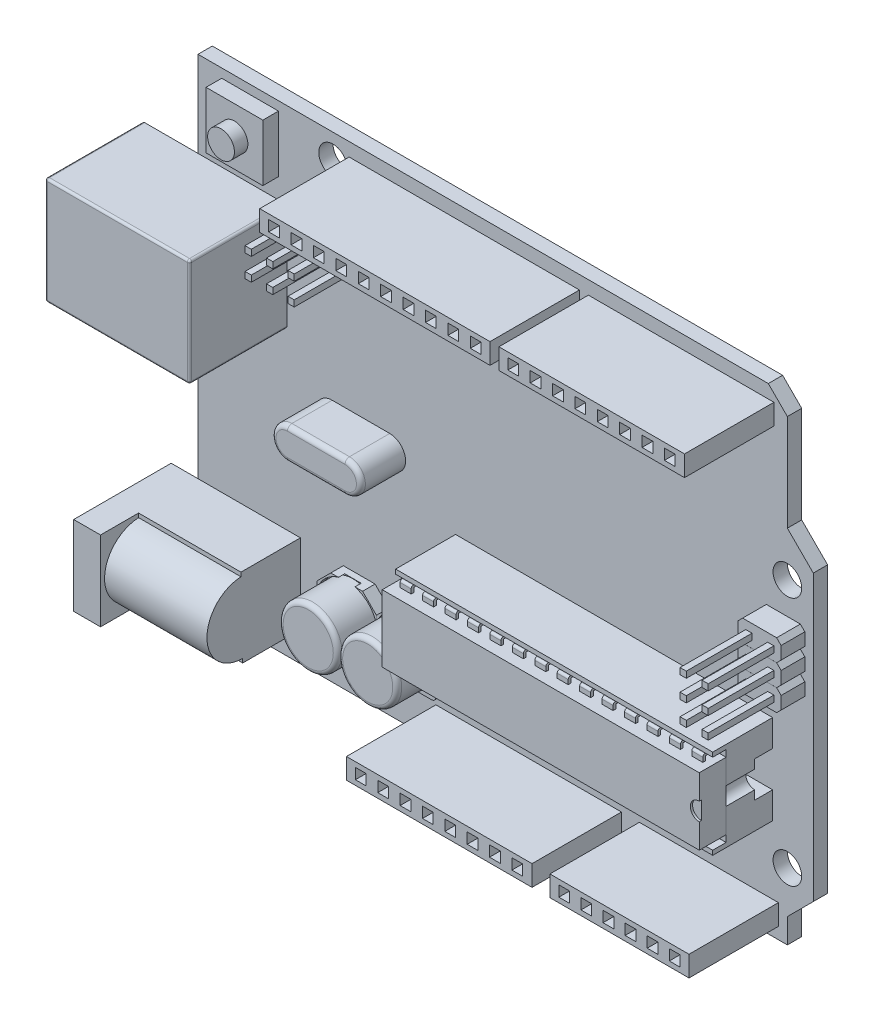
from build123d import *

# Parameters (mm, degrees)
ESQUISSE1_R                = 1.6
BOSS_EXTRU_1_DEPTH         = 1.6
ESQUISSE2_W                = 16.15
ESQUISSE2_H                = 12
BOSS_EXTRU_2_DEPTH         = 10.9
ESQUISSE3_W                = 14.45
ESQUISSE3_H                = 8.9
BOSS_EXTRU_3_DEPTH         = 10.9
ESQUISSE4_W                = 15.55
ESQUISSE4_H                = 2.3
ESQUISSE4_W_2              = 1.2
ESQUISSE4_H_2              = 1.2
BOSS_EXTRU_4_DEPTH         = 10
ENL_V_MAT_EXTRU_1_DEPTH    = 11.45
BOSS_EXTRU_5_DEPTH         = 5
ESQUISSE8_W                = 20.75
ESQUISSE8_H                = 2.3
ESQUISSE8_W_2              = 1.2
ESQUISSE8_H_2              = 1.2
BOSS_EXTRU_6_DEPTH         = 10
BOSS_EXTRU_7_DEPTH         = 1.4
ESQUISSE10_R               = 3.45
ENL_V_MAT_EXTRU_8_DEPTH    = 0.7
R_P_TITION_LIN_AIRE1_COUNT = 2
R_P_TITION_LIN_AIRE1_PITCH = 6.65
ESQUISSE11_R               = 3.3
BOSS_EXTRU_8_DEPTH         = 5
R_P_TITION_LIN_AIRE2_COUNT = 2
R_P_TITION_LIN_AIRE2_PITCH = 6.65
CONG_1_R                   = 0.5
CONG_2_R                   = 0.5
CONG_3_R                   = 0.5
BOSS_EXTRU_9_DEPTH         = 2.65
R_P_TITION_LIN_AIRE3_COUNT = 3
R_P_TITION_LIN_AIRE3_PITCH = 2.42
BOSS_EXTRU_10_DEPTH        = 2.65
R_P_TITION_LIN_AIRE4_COUNT = 3
R_P_TITION_LIN_AIRE4_PITCH = 2.42
ESQUISSE14_W               = 6.35
ESQUISSE14_H               = 6.35
BOSS_EXTRU_11_DEPTH        = 1.75
ESQUISSE15_R               = 1.5
BOSS_EXTRU_12_DEPTH        = 1.5
ESQUISSE16_W               = 0.7
ESQUISSE16_H               = 0.7
BOSS_EXTRU_13_DEPTH        = 7.35
BOSS_EXTRU_13_2_DEPTH      = 7.35
BOSS_EXTRU_13_3_DEPTH      = 7.35
BOSS_EXTRU_13_4_DEPTH      = 7.35
BOSS_EXTRU_13_5_DEPTH      = 7.35
BOSS_EXTRU_13_6_DEPTH      = 7.35
ESQUISSE17_W               = 0.7
ESQUISSE17_H               = 0.7
BOSS_EXTRU_14_DEPTH        = 7.35
BOSS_EXTRU_14_2_DEPTH      = 7.35
BOSS_EXTRU_14_3_DEPTH      = 7.35
BOSS_EXTRU_14_4_DEPTH      = 7.35
BOSS_EXTRU_14_5_DEPTH      = 7.35
BOSS_EXTRU_14_6_DEPTH      = 7.35
ESQUISSE19_W               = 20.75
ESQUISSE19_H               = 2.3
ESQUISSE19_W_2             = 1.2
ESQUISSE19_H_2             = 1.2
BOSS_EXTRU_15_DEPTH        = 10
ESQUISSE20_W               = 25.75
ESQUISSE20_H               = 2.3
ESQUISSE20_W_2             = 1.2
ESQUISSE20_H_2             = 1.2
BOSS_EXTRU_16_DEPTH        = 10
BOSS_EXTRU_17_DEPTH        = 6.7
ENL_V_START                = -64.25
ESQUISSE22_W               = 2
ESQUISSE22_H               = 4
ESQUISSE22_W_2             = 1.5
ESQUISSE22_H_2             = 9
ENL_V_MAT_EXTRU_9_DEPTH    = 68.8
ESQUISSE23_W               = 35.45
ESQUISSE23_H               = 7.5
BOSS_EXTRU_18_DEPTH        = 3
BOSS_EXTRU_19_START        = -1.2
ESQUISSE24_W               = 1.232150756
ESQUISSE24_H               = 0.75
BOSS_EXTRU_19_DEPTH        = 1.8
ESQUISSE24_W_2             = 1.232150757
BOSS_EXTRU_19_2_DEPTH      = 1.8
BOSS_EXTRU_19_3_DEPTH      = 1.8
BOSS_EXTRU_19_4_DEPTH      = 1.8
BOSS_EXTRU_19_5_DEPTH      = 1.8
BOSS_EXTRU_19_6_DEPTH      = 1.8
BOSS_EXTRU_19_7_DEPTH      = 1.8
BOSS_EXTRU_19_8_DEPTH      = 1.8
BOSS_EXTRU_19_9_DEPTH      = 1.8
BOSS_EXTRU_19_10_DEPTH     = 1.8
BOSS_EXTRU_19_11_DEPTH     = 1.8
BOSS_EXTRU_19_12_DEPTH     = 1.8
BOSS_EXTRU_19_13_DEPTH     = 1.8
BOSS_EXTRU_19_14_DEPTH     = 1.8
BOSS_EXTRU_19_15_DEPTH     = 1.8
BOSS_EXTRU_19_16_DEPTH     = 1.8
BOSS_EXTRU_19_17_DEPTH     = 1.8
BOSS_EXTRU_19_18_DEPTH     = 1.8
BOSS_EXTRU_19_19_DEPTH     = 1.8
BOSS_EXTRU_19_20_DEPTH     = 1.8
BOSS_EXTRU_19_21_DEPTH     = 1.8
BOSS_EXTRU_19_22_DEPTH     = 1.8
BOSS_EXTRU_19_23_DEPTH     = 1.8
BOSS_EXTRU_19_24_DEPTH     = 1.8
BOSS_EXTRU_19_25_DEPTH     = 1.8
BOSS_EXTRU_19_26_DEPTH     = 1.8
BOSS_EXTRU_19_27_DEPTH     = 1.8
BOSS_EXTRU_19_28_DEPTH     = 1.8
CONG_4_R                   = 0.25
CONG_5_R                   = 0.25
CONG_6_R                   = 0.25
CONG_7_R                   = 0.25
CONG_8_R                   = 0.25
CONG_9_R                   = 0.25
CONG_10_R                  = 0.25
CONG_11_R                  = 0.25
CONG_12_R                  = 0.25
CONG_13_R                  = 0.25
CONG_14_R                  = 0.25
CONG_15_R                  = 0.25
CONG_16_R                  = 0.25
CONG_17_R                  = 0.25
CONG_18_R                  = 0.25
CONG_19_R                  = 0.25
CONG_20_R                  = 0.25
CONG_21_R                  = 0.25
CONG_22_R                  = 0.25
CONG_23_R                  = 0.25
CONG_24_R                  = 0.25
CONG_25_R                  = 0.25
CONG_26_R                  = 0.25
CONG_27_R                  = 0.25
CONG_28_R                  = 0.25
CONG_29_R                  = 0.25
ESQUISSE25_R               = 3.05
ESQUISSE25_R_2             = 1
ENL_V_MAT_EXTRU_10_DEPTH   = 11
CONG_30_R                  = 1
ESQUISSE26_W               = 3
ESQUISSE26_H               = 5.25
ENL_V_MAT_EXTRU_11_DEPTH   = 10.15
ENL_V_START_2              = -34.65
ESQUISSE27_W               = 1.5
ESQUISSE27_H               = 0.5
ENL_V_MAT_EXTRU_12_DEPTH   = 35.45
CONG_31_R                  = 0.25
CONG_32_R                  = 0.25
CONG_33_R                  = 0.25
ESQUISSE28_R               = 1
ENL_V_MAT_EXTRU_13_DEPTH   = 0.25
ESQUISSE29_W               = 3
ESQUISSE29_H               = 3.9
BOSS_EXTRU_20_DEPTH        = 0.25
CONG_34_R                  = 0.25
BOSS_EXTRU_21_START        = -2
ESQUISSE30_W               = 0.3
ESQUISSE30_H               = 0.7
BOSS_EXTRU_21_DEPTH        = 8.15
BOSS_EXTRU_21_2_DEPTH      = 8.15
BOSS_EXTRU_21_3_DEPTH      = 8.15
BOSS_EXTRU_21_4_DEPTH      = 8.15


with BuildPart() as part:
    # Esquisse1 → Boss.-Extru.1 (new body)
    with BuildSketch(Plane.XY):
        Polygon((0, 0), (0, 53.3), (63.768866738, 53.3), (65.9, 51.168866738), (65.9, 40.358859802), (68.8, 37.458859802), (68.8, 5.65), (65.9, 2.75), (65.9, 0), align=None)
        with Locations((14, 2.75)):
            Circle(ESQUISSE1_R, mode=Mode.SUBTRACT)
        with Locations((15.1, 50.55)):
            Circle(ESQUISSE1_R, mode=Mode.SUBTRACT)
        with Locations((65.9, 7.45)):
            Circle(ESQUISSE1_R, mode=Mode.SUBTRACT)
        with Locations((65.9, 35.35)):
            Circle(ESQUISSE1_R, mode=Mode.SUBTRACT)
    extrude(amount=BOSS_EXTRU_1_DEPTH)

    # Esquisse13 → Boss.-Extru.10 (add)
    with BuildSketch(Plane.XY.offset(1.6)):
        Polygon((14.4, 43.9), (14.4, 47.7), (14.9, 48.2), (16.316666667, 48.2), (16.816666667, 47.7), (16.816666667, 43.9), (16.316666667, 43.4), (14.9, 43.4), align=None)
    boss_extru_10 = extrude(amount=BOSS_EXTRU_10_DEPTH)

    # Répétition linéaire4: Boss.-Extru.10 ×3
    with Locations(*[(i * R_P_TITION_LIN_AIRE4_PITCH, 0, 0) for i in range(1, R_P_TITION_LIN_AIRE4_COUNT)]):
        add(boss_extru_10)


with BuildPart() as body_2:
    # Esquisse2 → Boss.-Extru.2 (new body)
    with BuildSketch(Plane.XY.offset(1.6)):
        with Locations((1.875, 37.7)):
            Rectangle(ESQUISSE2_W, ESQUISSE2_H)
    extrude(amount=BOSS_EXTRU_2_DEPTH)

    # Congé29
    cong_29_edges = [body_2.edges().sort_by_distance(p)[0] for p in [
        (9.95, 37.7, 12.5),
        (1.875, 43.7, 12.5),
        (-6.2, 37.7, 12.5),
        (1.875, 31.7, 12.5),
        (-6.2, 43.7, 7.05),
        (9.95, 43.7, 7.05),
        (9.95, 31.7, 7.05),
        (-6.2, 31.7, 7.05),
    ]]
    fillet(cong_29_edges, radius=CONG_29_R)

    # Esquisse26 → Enlèv. mat.-Extru.11 (cut)
    with BuildSketch(Plane.ZY.offset(6.2)):
        Polygon((9.55, 41.947925456), (3.75, 41.947925456), (3.75, 33.447925456), (9.55, 33.447925456), (11.3, 35.197925456), (11.3, 40.197925456), align=None)
        with Locations((7.45, 37.697925456)):
            Rectangle(ESQUISSE26_W, ESQUISSE26_H, mode=Mode.SUBTRACT)
    extrude(amount=-ENL_V_MAT_EXTRU_11_DEPTH, mode=Mode.SUBTRACT)


with BuildPart() as body_3:
    # Esquisse3 → Boss.-Extru.3 (new body)
    with BuildSketch(Plane.XY.offset(1.6)):
        with Locations((4.225, 7.75)):
            Rectangle(ESQUISSE3_W, ESQUISSE3_H)
    extrude(amount=BOSS_EXTRU_3_DEPTH)

    # Esquisse5 → Enlèv. mat.-Extru.1 (cut)
    with BuildSketch(Plane(origin=(11.45, 0, 0), x_dir=(0, 0, -1), z_dir=(1, 0, 0))):
        with BuildLine():
            Line((-8.050002587, 3.754798233), (-8.050002587, 3.3))
            Line((-8.050002587, 3.3), (-12.5, 3.3))
            Line((-12.5, 3.3), (-12.5, 12.2))
            Line((-12.5, 12.2), (-8.245866933, 12.2))
            Line((-8.245866933, 12.2), (-8.245866933, 11.75))
            ThreePointArc((-8.245866933, 11.75), (-12.048802849, 7.656836678), (-8.050002587, 3.754798233))
        make_face()
    extrude(amount=-ENL_V_MAT_EXTRU_1_DEPTH, mode=Mode.SUBTRACT)

    # Esquisse25 → Enlèv. mat.-Extru.10 (cut)
    with BuildSketch(Plane.ZY.offset(3)):
        with Locations(Location((8.1, 7.8, 0), (0, 0, 270))):
            Circle(ESQUISSE25_R)
        with Locations(Location((8.1, 7.8, 0), (0, 0, 270))):
            Circle(ESQUISSE25_R_2, mode=Mode.SUBTRACT)
    extrude(amount=-ENL_V_MAT_EXTRU_10_DEPTH, mode=Mode.SUBTRACT)

    # Congé30
    cong_30_edges = [body_3.edges().sort_by_distance(p)[0] for p in [
        (-3, 8.8, 8.1),
    ]]
    fillet(cong_30_edges, radius=CONG_30_R)


with BuildPart() as body_4:
    # Esquisse4 → Boss.-Extru.4 (new body)
    with BuildSketch(Plane.XY.offset(1.6)):
        with Locations((57.125, 2.45)):
            Rectangle(ESQUISSE4_W, ESQUISSE4_H)
        with Locations((50.95, 2.45)):
            Rectangle(ESQUISSE4_W_2, ESQUISSE4_H_2, mode=Mode.SUBTRACT)
        with Locations((53.42, 2.45)):
            Rectangle(ESQUISSE4_W_2, ESQUISSE4_H_2, mode=Mode.SUBTRACT)
        with Locations((55.89, 2.45)):
            Rectangle(ESQUISSE4_W_2, ESQUISSE4_H_2, mode=Mode.SUBTRACT)
        with Locations((58.36, 2.45)):
            Rectangle(ESQUISSE4_W_2, ESQUISSE4_H_2, mode=Mode.SUBTRACT)
        with Locations((60.83, 2.45)):
            Rectangle(ESQUISSE4_W_2, ESQUISSE4_H_2, mode=Mode.SUBTRACT)
        with Locations((63.3, 2.45)):
            Rectangle(ESQUISSE4_W_2, ESQUISSE4_H_2, mode=Mode.SUBTRACT)
    extrude(amount=BOSS_EXTRU_4_DEPTH)


with BuildPart() as body_5:
    # Esquisse6 → Boss.-Extru.5 (new body)
    with BuildSketch(Plane.XY.offset(1.6)):
        with BuildLine():
            Line((15, 27.3), (21.44, 27.3))
            ThreePointArc((21.44, 27.3), (23.215, 25.525), (21.44, 23.75))
            Line((21.44, 23.75), (15, 23.75))
            ThreePointArc((15, 23.75), (13.225, 25.525), (15, 27.3))
        make_face()
    extrude(amount=BOSS_EXTRU_5_DEPTH)

    # Congé3
    cong_3_edges = [body_5.edges().sort_by_distance(p)[0] for p in [
        (23.215, 25.525, 6.6),
        (18.22, 27.3, 6.6),
        (13.225, 25.525, 6.6),
        (18.22, 23.75, 6.6),
    ]]
    fillet(cong_3_edges, radius=CONG_3_R)


with BuildPart() as body_6:
    # Esquisse8 → Boss.-Extru.6 (new body)
    with BuildSketch(Plane.XY.offset(1.6)):
        with Locations((36.975, 2.45)):
            Rectangle(ESQUISSE8_W, ESQUISSE8_H)
        with Locations((28.2, 2.45)):
            Rectangle(ESQUISSE8_W_2, ESQUISSE8_H_2, mode=Mode.SUBTRACT)
        with Locations((30.7, 2.45)):
            Rectangle(ESQUISSE8_W_2, ESQUISSE8_H_2, mode=Mode.SUBTRACT)
        with Locations((33.2, 2.45)):
            Rectangle(ESQUISSE8_W_2, ESQUISSE8_H_2, mode=Mode.SUBTRACT)
        with Locations((35.7, 2.45)):
            Rectangle(ESQUISSE8_W_2, ESQUISSE8_H_2, mode=Mode.SUBTRACT)
        with Locations((38.2, 2.45)):
            Rectangle(ESQUISSE8_W_2, ESQUISSE8_H_2, mode=Mode.SUBTRACT)
        with Locations((40.7, 2.45)):
            Rectangle(ESQUISSE8_W_2, ESQUISSE8_H_2, mode=Mode.SUBTRACT)
        with Locations((43.2, 2.45)):
            Rectangle(ESQUISSE8_W_2, ESQUISSE8_H_2, mode=Mode.SUBTRACT)
        with Locations((45.7, 2.45)):
            Rectangle(ESQUISSE8_W_2, ESQUISSE8_H_2, mode=Mode.SUBTRACT)
    extrude(amount=BOSS_EXTRU_6_DEPTH)


with BuildPart() as body_7:
    # Esquisse9 → Boss.-Extru.7 (new body)
    with BuildSketch(Plane.XY.offset(1.6)):
        with BuildLine():
            Line((14.7, 10.35), (14.7, 5.75))
            ThreePointArc((14.7, 5.75), (14.846446609, 5.396446609), (15.2, 5.25))
            Line((15.2, 5.25), (20.85, 5.25))
            ThreePointArc((20.85, 5.25), (21.203553391, 5.396446609), (21.35, 5.75))
            Line((21.35, 5.75), (21.35, 10.35))
            Line((21.35, 10.35), (19.8, 11.9))
            Line((19.8, 11.9), (16.25, 11.9))
            Line((16.25, 11.9), (14.7, 10.35))
        make_face()
    extrude(amount=BOSS_EXTRU_7_DEPTH)

    # Esquisse10 → Enlèv. mat.-Extru.8 (cut)
    with BuildSketch(Plane.XY.offset(3)):
        with Locations((18.025, 8.575)):
            Circle(ESQUISSE10_R)
    extrude(amount=-ENL_V_MAT_EXTRU_8_DEPTH, mode=Mode.SUBTRACT)


with BuildPart() as r_p_tition_lin_aire1_1:
    # Répétition linéaire1: pattern copy
    add(body_7.part.moved(Location(Vector(1, 0, 0) * (1 * R_P_TITION_LIN_AIRE1_PITCH))))


with BuildPart() as body_9:
    # Esquisse11 → Boss.-Extru.8 (new body)
    with BuildSketch(Plane.XY.offset(2.3)):
        with Locations((18.025, 8.575)):
            Circle(ESQUISSE11_R)
    boss_extru_8 = extrude(amount=BOSS_EXTRU_8_DEPTH)

    # Congé1
    cong_1_edges = [body_9.edges().sort_by_distance(p)[0] for p in [
        (14.725, 8.575, 7.3),
    ]]
    fillet(cong_1_edges, radius=CONG_1_R)


with BuildPart() as r_p_tition_lin_aire2_1:
    # Répétition linéaire2: Boss.-Extru.8 ×2
    with Locations(*[(i * R_P_TITION_LIN_AIRE2_PITCH, 0, 0) for i in range(1, R_P_TITION_LIN_AIRE2_COUNT)]):
        add(boss_extru_8)

    # Congé2
    cong_2_edges = [r_p_tition_lin_aire2_1.edges().sort_by_distance(p)[0] for p in [
        (21.375, 8.575, 7.3),
    ]]
    fillet(cong_2_edges, radius=CONG_2_R)


with BuildPart() as body_11:
    # Esquisse12 → Boss.-Extru.9 (new body)
    with BuildSketch(Plane.XY.offset(1.6)):
        Polygon((63.55, 31.8), (67.35, 31.8), (67.85, 31.3), (67.85, 29.883333333), (67.35, 29.383333333), (63.55, 29.383333333), (63.05, 29.883333333), (63.05, 31.3), align=None)
    extrude(amount=BOSS_EXTRU_9_DEPTH)


with BuildPart() as r_p_tition_lin_aire3_1:
    # Répétition linéaire3: pattern copy
    add(body_11.part.moved(Location(Vector(0, -1, 0) * (1 * R_P_TITION_LIN_AIRE3_PITCH))))


with BuildPart() as r_p_tition_lin_aire3_2:
    # Répétition linéaire3: pattern copy
    add(body_11.part.moved(Location(Vector(0, -1, 0) * (2 * R_P_TITION_LIN_AIRE3_PITCH))))


with BuildPart() as body_14:
    # Esquisse14 → Boss.-Extru.11 (new body)
    with BuildSketch(Plane.XY.offset(1.6)):
        with Locations((5.825, 49.125)):
            Rectangle(ESQUISSE14_W, ESQUISSE14_H)
    extrude(amount=BOSS_EXTRU_11_DEPTH)


with BuildPart() as body_15:
    # Esquisse15 → Boss.-Extru.12 (new body)
    with BuildSketch(Plane.XY.offset(3.35)):
        with Locations((5.825, 49.125)):
            Circle(ESQUISSE15_R)
    extrude(amount=BOSS_EXTRU_12_DEPTH)


with BuildPart() as body_16:
    # Esquisse16 → Boss.-Extru.13 (new body)
    with BuildSketch(Plane.XY.offset(4.25)):
        with Locations((66.7, 25.75)):
            Rectangle(ESQUISSE16_W, ESQUISSE16_H)
    extrude(amount=BOSS_EXTRU_13_DEPTH)


with BuildPart() as body_17:
    # Esquisse16 → Boss.-Extru.13 2 (new body)
    with BuildSketch(Plane.XY.offset(4.25)):
        with Locations((64.25, 25.75)):
            Rectangle(ESQUISSE16_W, ESQUISSE16_H)
    extrude(amount=BOSS_EXTRU_13_2_DEPTH)


with BuildPart() as body_18:
    # Esquisse16 → Boss.-Extru.13 3 (new body)
    with BuildSketch(Plane.XY.offset(4.25)):
        with Locations((64.25, 28.133333333)):
            Rectangle(ESQUISSE16_W, ESQUISSE16_H)
    extrude(amount=BOSS_EXTRU_13_3_DEPTH)


with BuildPart() as body_19:
    # Esquisse16 → Boss.-Extru.13 4 (new body)
    with BuildSketch(Plane.XY.offset(4.25)):
        with Locations((64.25, 30.516666667)):
            Rectangle(ESQUISSE16_W, ESQUISSE16_H)
    extrude(amount=BOSS_EXTRU_13_4_DEPTH)


with BuildPart() as body_20:
    # Esquisse16 → Boss.-Extru.13 5 (new body)
    with BuildSketch(Plane.XY.offset(4.25)):
        with Locations((66.7, 28.133333333)):
            Rectangle(ESQUISSE16_W, ESQUISSE16_H)
    extrude(amount=BOSS_EXTRU_13_5_DEPTH)


with BuildPart() as body_21:
    # Esquisse16 → Boss.-Extru.13 6 (new body)
    with BuildSketch(Plane.XY.offset(4.25)):
        with Locations((66.7, 30.516666667)):
            Rectangle(ESQUISSE16_W, ESQUISSE16_H)
    extrude(amount=BOSS_EXTRU_13_6_DEPTH)


with BuildPart() as body_22:
    # Esquisse17 → Boss.-Extru.14 (new body)
    with BuildSketch(Plane.XY.offset(4.25)):
        with Locations((15.61, 44.55)):
            Rectangle(ESQUISSE17_W, ESQUISSE17_H)
    extrude(amount=BOSS_EXTRU_14_DEPTH)


with BuildPart() as body_23:
    # Esquisse17 → Boss.-Extru.14 2 (new body)
    with BuildSketch(Plane.XY.offset(4.25)):
        with Locations((15.61, 47.05)):
            Rectangle(ESQUISSE17_W, ESQUISSE17_H)
    extrude(amount=BOSS_EXTRU_14_2_DEPTH)


with BuildPart() as body_24:
    # Esquisse17 → Boss.-Extru.14 3 (new body)
    with BuildSketch(Plane.XY.offset(4.25)):
        with Locations((18.01, 47.05)):
            Rectangle(ESQUISSE17_W, ESQUISSE17_H)
    extrude(amount=BOSS_EXTRU_14_3_DEPTH)


with BuildPart() as body_25:
    # Esquisse17 → Boss.-Extru.14 4 (new body)
    with BuildSketch(Plane.XY.offset(4.25)):
        with Locations((18.01, 44.55)):
            Rectangle(ESQUISSE17_W, ESQUISSE17_H)
    extrude(amount=BOSS_EXTRU_14_4_DEPTH)


with BuildPart() as body_26:
    # Esquisse17 → Boss.-Extru.14 5 (new body)
    with BuildSketch(Plane.XY.offset(4.25)):
        with Locations((20.41, 47.05)):
            Rectangle(ESQUISSE17_W, ESQUISSE17_H)
    extrude(amount=BOSS_EXTRU_14_5_DEPTH)


with BuildPart() as body_27:
    # Esquisse17 → Boss.-Extru.14 6 (new body)
    with BuildSketch(Plane.XY.offset(4.25)):
        with Locations((20.41, 44.55)):
            Rectangle(ESQUISSE17_W, ESQUISSE17_H)
    extrude(amount=BOSS_EXTRU_14_6_DEPTH)


with BuildPart() as body_28:
    # Esquisse19 → Boss.-Extru.15 (new body)
    with BuildSketch(Plane.XY.offset(1.6)):
        with Locations((54.025, 50.65)):
            Rectangle(ESQUISSE19_W, ESQUISSE19_H)
        with Locations((45.25, 50.65)):
            Rectangle(ESQUISSE19_W_2, ESQUISSE19_H_2, mode=Mode.SUBTRACT)
        with Locations((47.75, 50.65)):
            Rectangle(ESQUISSE19_W_2, ESQUISSE19_H_2, mode=Mode.SUBTRACT)
        with Locations((50.25, 50.65)):
            Rectangle(ESQUISSE19_W_2, ESQUISSE19_H_2, mode=Mode.SUBTRACT)
        with Locations((52.75, 50.65)):
            Rectangle(ESQUISSE19_W_2, ESQUISSE19_H_2, mode=Mode.SUBTRACT)
        with Locations((55.25, 50.65)):
            Rectangle(ESQUISSE19_W_2, ESQUISSE19_H_2, mode=Mode.SUBTRACT)
        with Locations((57.75, 50.65)):
            Rectangle(ESQUISSE19_W_2, ESQUISSE19_H_2, mode=Mode.SUBTRACT)
        with Locations((60.25, 50.65)):
            Rectangle(ESQUISSE19_W_2, ESQUISSE19_H_2, mode=Mode.SUBTRACT)
        with Locations((62.75, 50.65)):
            Rectangle(ESQUISSE19_W_2, ESQUISSE19_H_2, mode=Mode.SUBTRACT)
    extrude(amount=BOSS_EXTRU_15_DEPTH)


with BuildPart() as body_29:
    # Esquisse20 → Boss.-Extru.16 (new body)
    with BuildSketch(Plane.XY.offset(1.6)):
        with Locations((29.775, 50.65)):
            Rectangle(ESQUISSE20_W, ESQUISSE20_H)
        with Locations((41.05, 50.65)):
            Rectangle(ESQUISSE20_W_2, ESQUISSE20_H_2, mode=Mode.SUBTRACT)
        with Locations((38.544444444, 50.65)):
            Rectangle(ESQUISSE20_W_2, ESQUISSE20_H_2, mode=Mode.SUBTRACT)
        with Locations((36.038888889, 50.65)):
            Rectangle(ESQUISSE20_W_2, ESQUISSE20_H_2, mode=Mode.SUBTRACT)
        with Locations((33.533333333, 50.65)):
            Rectangle(ESQUISSE20_W_2, ESQUISSE20_H_2, mode=Mode.SUBTRACT)
        with Locations((31.027777778, 50.65)):
            Rectangle(ESQUISSE20_W_2, ESQUISSE20_H_2, mode=Mode.SUBTRACT)
        with Locations((28.522222222, 50.65)):
            Rectangle(ESQUISSE20_W_2, ESQUISSE20_H_2, mode=Mode.SUBTRACT)
        with Locations((26.016666667, 50.65)):
            Rectangle(ESQUISSE20_W_2, ESQUISSE20_H_2, mode=Mode.SUBTRACT)
        with Locations((23.511111111, 50.65)):
            Rectangle(ESQUISSE20_W_2, ESQUISSE20_H_2, mode=Mode.SUBTRACT)
        with Locations((21.005555556, 50.65)):
            Rectangle(ESQUISSE20_W_2, ESQUISSE20_H_2, mode=Mode.SUBTRACT)
        with Locations((18.5, 50.65)):
            Rectangle(ESQUISSE20_W_2, ESQUISSE20_H_2, mode=Mode.SUBTRACT)
    extrude(amount=BOSS_EXTRU_16_DEPTH)


with BuildPart() as body_30:
    # Esquisse21 → Boss.-Extru.17 (new body)
    with BuildSketch(Plane.XY.offset(1.6)):
        with BuildLine():
            Line((64.25, 11.2), (28.8, 11.2))
            Line((28.8, 11.2), (28.8, 21.2))
            Line((28.8, 21.2), (64.25, 21.2))
            Line((64.25, 21.2), (64.25, 17.2))
            ThreePointArc((64.25, 17.2), (63.25, 16.2), (64.25, 15.2))
            Line((64.25, 15.2), (64.25, 11.2))
        make_face()
    extrude(amount=BOSS_EXTRU_17_DEPTH)

    # Esquisse22 → Enlèv. mat.-Extru.9 (cut)
    with BuildSketch(Plane(origin=(64.25, 0, 0), x_dir=(0, 0, -1), z_dir=(1, 0, 0)).offset(ENL_V_START)):
        with Locations((-2.6, 16.2)):
            Rectangle(ESQUISSE22_W, ESQUISSE22_H)
        with Locations((-7.55, 16.2)):
            Rectangle(ESQUISSE22_W_2, ESQUISSE22_H_2)
    extrude(amount=ENL_V_MAT_EXTRU_9_DEPTH, mode=Mode.SUBTRACT)


with BuildPart() as body_31:
    # Esquisse23 → Boss.-Extru.18 (new body)
    with BuildSketch(Plane.XY.offset(6.8)):
        with Locations((46.525, 16.2)):
            Rectangle(ESQUISSE23_W, ESQUISSE23_H)
    extrude(amount=BOSS_EXTRU_18_DEPTH)

    # Esquisse28 → Enlèv. mat.-Extru.13 (cut)
    with BuildSketch(Plane.XY.offset(9.8)):
        with Locations((64.25, 16.2)):
            Circle(ESQUISSE28_R)
    extrude(amount=-ENL_V_MAT_EXTRU_13_DEPTH, mode=Mode.SUBTRACT)


with BuildPart() as body_32:
    # Esquisse24 → Boss.-Extru.19 (new body)
    with BuildSketch(Plane.XY.offset(9.8).offset(BOSS_EXTRU_19_START)):
        with Locations((30.216075378, 20.325)):
            Rectangle(ESQUISSE24_W, ESQUISSE24_H)
    extrude(amount=-BOSS_EXTRU_19_DEPTH)

    # Congé16
    cong_16_edges = [body_32.edges().sort_by_distance(p)[0] for p in [
        (30.216075378, 20.7, 8.6),
    ]]
    fillet(cong_16_edges, radius=CONG_16_R)


with BuildPart() as body_33:
    # Esquisse24 → Boss.-Extru.19 2 (new body)
    with BuildSketch(Plane.XY.offset(9.8).offset(BOSS_EXTRU_19_START)):
        with Locations((32.725140704, 20.325)):
            Rectangle(ESQUISSE24_W_2, ESQUISSE24_H)
    extrude(amount=-BOSS_EXTRU_19_2_DEPTH)

    # Congé17
    cong_17_edges = [body_33.edges().sort_by_distance(p)[0] for p in [
        (32.725140705, 20.7, 8.6),
    ]]
    fillet(cong_17_edges, radius=CONG_17_R)


with BuildPart() as body_34:
    # Esquisse24 → Boss.-Extru.19 3 (new body)
    with BuildSketch(Plane.XY.offset(9.8).offset(BOSS_EXTRU_19_START)):
        with Locations((35.234206031, 20.325)):
            Rectangle(ESQUISSE24_W, ESQUISSE24_H)
    extrude(amount=-BOSS_EXTRU_19_3_DEPTH)

    # Congé19
    cong_19_edges = [body_34.edges().sort_by_distance(p)[0] for p in [
        (35.234206031, 20.7, 8.6),
    ]]
    fillet(cong_19_edges, radius=CONG_19_R)


with BuildPart() as body_35:
    # Esquisse24 → Boss.-Extru.19 4 (new body)
    with BuildSketch(Plane.XY.offset(9.8).offset(BOSS_EXTRU_19_START)):
        with Locations((37.743271357, 20.325)):
            Rectangle(ESQUISSE24_W_2, ESQUISSE24_H)
    extrude(amount=-BOSS_EXTRU_19_4_DEPTH)

    # Congé18
    cong_18_edges = [body_35.edges().sort_by_distance(p)[0] for p in [
        (37.743271358, 20.7, 8.6),
    ]]
    fillet(cong_18_edges, radius=CONG_18_R)


with BuildPart() as body_36:
    # Esquisse24 → Boss.-Extru.19 5 (new body)
    with BuildSketch(Plane.XY.offset(9.8).offset(BOSS_EXTRU_19_START)):
        with Locations((40.252336684, 20.325)):
            Rectangle(ESQUISSE24_W, ESQUISSE24_H)
    extrude(amount=-BOSS_EXTRU_19_5_DEPTH)

    # Congé20
    cong_20_edges = [body_36.edges().sort_by_distance(p)[0] for p in [
        (40.252336684, 20.7, 8.6),
    ]]
    fillet(cong_20_edges, radius=CONG_20_R)


with BuildPart() as body_37:
    # Esquisse24 → Boss.-Extru.19 6 (new body)
    with BuildSketch(Plane.XY.offset(9.8).offset(BOSS_EXTRU_19_START)):
        with Locations((42.76140201, 20.325)):
            Rectangle(ESQUISSE24_W_2, ESQUISSE24_H)
    extrude(amount=-BOSS_EXTRU_19_6_DEPTH)

    # Congé21
    cong_21_edges = [body_37.edges().sort_by_distance(p)[0] for p in [
        (42.76140201, 20.7, 8.6),
    ]]
    fillet(cong_21_edges, radius=CONG_21_R)


with BuildPart() as body_38:
    # Esquisse24 → Boss.-Extru.19 7 (new body)
    with BuildSketch(Plane.XY.offset(9.8).offset(BOSS_EXTRU_19_START)):
        with Locations((45.270467337, 20.325)):
            Rectangle(ESQUISSE24_W, ESQUISSE24_H)
    extrude(amount=-BOSS_EXTRU_19_7_DEPTH)


with BuildPart() as body_39:
    # Esquisse24 → Boss.-Extru.19 8 (new body)
    with BuildSketch(Plane.XY.offset(9.8).offset(BOSS_EXTRU_19_START)):
        with Locations((47.779532663, 20.325)):
            Rectangle(ESQUISSE24_W, ESQUISSE24_H)
    extrude(amount=-BOSS_EXTRU_19_8_DEPTH)

    # Congé22
    cong_22_edges = [body_39.edges().sort_by_distance(p)[0] for p in [
        (47.779532663, 20.7, 8.6),
    ]]
    fillet(cong_22_edges, radius=CONG_22_R)


with BuildPart() as body_40:
    # Esquisse24 → Boss.-Extru.19 9 (new body)
    with BuildSketch(Plane.XY.offset(9.8).offset(BOSS_EXTRU_19_START)):
        with Locations((50.28859799, 20.325)):
            Rectangle(ESQUISSE24_W_2, ESQUISSE24_H)
    extrude(amount=-BOSS_EXTRU_19_9_DEPTH)

    # Congé23
    cong_23_edges = [body_40.edges().sort_by_distance(p)[0] for p in [
        (50.28859799, 20.7, 8.6),
    ]]
    fillet(cong_23_edges, radius=CONG_23_R)


with BuildPart() as body_41:
    # Esquisse24 → Boss.-Extru.19 10 (new body)
    with BuildSketch(Plane.XY.offset(9.8).offset(BOSS_EXTRU_19_START)):
        with Locations((52.797663316, 20.325)):
            Rectangle(ESQUISSE24_W, ESQUISSE24_H)
    extrude(amount=-BOSS_EXTRU_19_10_DEPTH)

    # Congé24
    cong_24_edges = [body_41.edges().sort_by_distance(p)[0] for p in [
        (52.797663316, 20.7, 8.6),
    ]]
    fillet(cong_24_edges, radius=CONG_24_R)


with BuildPart() as body_42:
    # Esquisse24 → Boss.-Extru.19 11 (new body)
    with BuildSketch(Plane.XY.offset(9.8).offset(BOSS_EXTRU_19_START)):
        with Locations((55.306728643, 20.325)):
            Rectangle(ESQUISSE24_W_2, ESQUISSE24_H)
    extrude(amount=-BOSS_EXTRU_19_11_DEPTH)

    # Congé25
    cong_25_edges = [body_42.edges().sort_by_distance(p)[0] for p in [
        (55.306728642, 20.7, 8.6),
    ]]
    fillet(cong_25_edges, radius=CONG_25_R)


with BuildPart() as body_43:
    # Esquisse24 → Boss.-Extru.19 12 (new body)
    with BuildSketch(Plane.XY.offset(9.8).offset(BOSS_EXTRU_19_START)):
        with Locations((57.815793969, 20.325)):
            Rectangle(ESQUISSE24_W, ESQUISSE24_H)
    extrude(amount=-BOSS_EXTRU_19_12_DEPTH)

    # Congé26
    cong_26_edges = [body_43.edges().sort_by_distance(p)[0] for p in [
        (57.815793969, 20.7, 8.6),
    ]]
    fillet(cong_26_edges, radius=CONG_26_R)


with BuildPart() as body_44:
    # Esquisse24 → Boss.-Extru.19 13 (new body)
    with BuildSketch(Plane.XY.offset(9.8).offset(BOSS_EXTRU_19_START)):
        with Locations((60.324859296, 20.325)):
            Rectangle(ESQUISSE24_W_2, ESQUISSE24_H)
    extrude(amount=-BOSS_EXTRU_19_13_DEPTH)

    # Congé27
    cong_27_edges = [body_44.edges().sort_by_distance(p)[0] for p in [
        (60.324859295, 20.7, 8.6),
    ]]
    fillet(cong_27_edges, radius=CONG_27_R)


with BuildPart() as body_45:
    # Esquisse24 → Boss.-Extru.19 14 (new body)
    with BuildSketch(Plane.XY.offset(9.8).offset(BOSS_EXTRU_19_START)):
        with Locations((62.833924622, 20.325)):
            Rectangle(ESQUISSE24_W, ESQUISSE24_H)
    extrude(amount=-BOSS_EXTRU_19_14_DEPTH)

    # Congé28
    cong_28_edges = [body_45.edges().sort_by_distance(p)[0] for p in [
        (62.833924622, 20.7, 8.6),
    ]]
    fillet(cong_28_edges, radius=CONG_28_R)


with BuildPart() as body_46:
    # Esquisse24 → Boss.-Extru.19 15 (new body)
    with BuildSketch(Plane.XY.offset(9.8).offset(BOSS_EXTRU_19_START)):
        with Locations((32.725140704, 12.075)):
            Rectangle(ESQUISSE24_W_2, ESQUISSE24_H)
    extrude(amount=-BOSS_EXTRU_19_15_DEPTH)

    # Congé5
    cong_5_edges = [body_46.edges().sort_by_distance(p)[0] for p in [
        (32.725140705, 11.7, 8.6),
    ]]
    fillet(cong_5_edges, radius=CONG_5_R)


with BuildPart() as body_47:
    # Esquisse24 → Boss.-Extru.19 16 (new body)
    with BuildSketch(Plane.XY.offset(9.8).offset(BOSS_EXTRU_19_START)):
        with Locations((35.234206031, 12.075)):
            Rectangle(ESQUISSE24_W, ESQUISSE24_H)
    extrude(amount=-BOSS_EXTRU_19_16_DEPTH)

    # Congé6
    cong_6_edges = [body_47.edges().sort_by_distance(p)[0] for p in [
        (35.234206031, 11.7, 8.6),
    ]]
    fillet(cong_6_edges, radius=CONG_6_R)


with BuildPart() as body_48:
    # Esquisse24 → Boss.-Extru.19 17 (new body)
    with BuildSketch(Plane.XY.offset(9.8).offset(BOSS_EXTRU_19_START)):
        with Locations((37.743271357, 12.075)):
            Rectangle(ESQUISSE24_W_2, ESQUISSE24_H)
    extrude(amount=-BOSS_EXTRU_19_17_DEPTH)

    # Congé7
    cong_7_edges = [body_48.edges().sort_by_distance(p)[0] for p in [
        (37.743271358, 11.7, 8.6),
    ]]
    fillet(cong_7_edges, radius=CONG_7_R)


with BuildPart() as body_49:
    # Esquisse24 → Boss.-Extru.19 18 (new body)
    with BuildSketch(Plane.XY.offset(9.8).offset(BOSS_EXTRU_19_START)):
        with Locations((40.252336684, 12.075)):
            Rectangle(ESQUISSE24_W, ESQUISSE24_H)
    extrude(amount=-BOSS_EXTRU_19_18_DEPTH)

    # Congé8
    cong_8_edges = [body_49.edges().sort_by_distance(p)[0] for p in [
        (40.252336684, 11.7, 8.6),
    ]]
    fillet(cong_8_edges, radius=CONG_8_R)


with BuildPart() as body_50:
    # Esquisse24 → Boss.-Extru.19 19 (new body)
    with BuildSketch(Plane.XY.offset(9.8).offset(BOSS_EXTRU_19_START)):
        with Locations((42.76140201, 12.075)):
            Rectangle(ESQUISSE24_W_2, ESQUISSE24_H)
    extrude(amount=-BOSS_EXTRU_19_19_DEPTH)

    # Congé9
    cong_9_edges = [body_50.edges().sort_by_distance(p)[0] for p in [
        (42.76140201, 11.7, 8.6),
    ]]
    fillet(cong_9_edges, radius=CONG_9_R)


with BuildPart() as body_51:
    # Esquisse24 → Boss.-Extru.19 20 (new body)
    with BuildSketch(Plane.XY.offset(9.8).offset(BOSS_EXTRU_19_START)):
        with Locations((45.270467337, 12.075)):
            Rectangle(ESQUISSE24_W, ESQUISSE24_H)
    extrude(amount=-BOSS_EXTRU_19_20_DEPTH)

    # Congé10
    cong_10_edges = [body_51.edges().sort_by_distance(p)[0] for p in [
        (45.270467337, 11.7, 8.6),
    ]]
    fillet(cong_10_edges, radius=CONG_10_R)


with BuildPart() as body_52:
    # Esquisse24 → Boss.-Extru.19 21 (new body)
    with BuildSketch(Plane.XY.offset(9.8).offset(BOSS_EXTRU_19_START)):
        with Locations((47.779532663, 12.075)):
            Rectangle(ESQUISSE24_W, ESQUISSE24_H)
    extrude(amount=-BOSS_EXTRU_19_21_DEPTH)

    # Congé11
    cong_11_edges = [body_52.edges().sort_by_distance(p)[0] for p in [
        (47.779532663, 11.7, 8.6),
    ]]
    fillet(cong_11_edges, radius=CONG_11_R)


with BuildPart() as body_53:
    # Esquisse24 → Boss.-Extru.19 22 (new body)
    with BuildSketch(Plane.XY.offset(9.8).offset(BOSS_EXTRU_19_START)):
        with Locations((50.28859799, 12.075)):
            Rectangle(ESQUISSE24_W_2, ESQUISSE24_H)
    extrude(amount=-BOSS_EXTRU_19_22_DEPTH)

    # Congé12
    cong_12_edges = [body_53.edges().sort_by_distance(p)[0] for p in [
        (50.28859799, 11.7, 8.6),
    ]]
    fillet(cong_12_edges, radius=CONG_12_R)


with BuildPart() as body_54:
    # Esquisse24 → Boss.-Extru.19 23 (new body)
    with BuildSketch(Plane.XY.offset(9.8).offset(BOSS_EXTRU_19_START)):
        with Locations((52.797663316, 12.075)):
            Rectangle(ESQUISSE24_W, ESQUISSE24_H)
    extrude(amount=-BOSS_EXTRU_19_23_DEPTH)

    # Congé13
    cong_13_edges = [body_54.edges().sort_by_distance(p)[0] for p in [
        (52.797663316, 11.7, 8.6),
    ]]
    fillet(cong_13_edges, radius=CONG_13_R)


with BuildPart() as body_55:
    # Esquisse24 → Boss.-Extru.19 24 (new body)
    with BuildSketch(Plane.XY.offset(9.8).offset(BOSS_EXTRU_19_START)):
        with Locations((55.306728643, 12.075)):
            Rectangle(ESQUISSE24_W_2, ESQUISSE24_H)
    extrude(amount=-BOSS_EXTRU_19_24_DEPTH)

    # Congé14
    cong_14_edges = [body_55.edges().sort_by_distance(p)[0] for p in [
        (55.306728642, 11.7, 8.6),
    ]]
    fillet(cong_14_edges, radius=CONG_14_R)


with BuildPart() as body_56:
    # Esquisse24 → Boss.-Extru.19 25 (new body)
    with BuildSketch(Plane.XY.offset(9.8).offset(BOSS_EXTRU_19_START)):
        with Locations((57.815793969, 12.075)):
            Rectangle(ESQUISSE24_W, ESQUISSE24_H)
    extrude(amount=-BOSS_EXTRU_19_25_DEPTH)

    # Congé15
    cong_15_edges = [body_56.edges().sort_by_distance(p)[0] for p in [
        (57.815793969, 11.7, 8.6),
    ]]
    fillet(cong_15_edges, radius=CONG_15_R)


with BuildPart() as body_57:
    # Esquisse24 → Boss.-Extru.19 26 (new body)
    with BuildSketch(Plane.XY.offset(9.8).offset(BOSS_EXTRU_19_START)):
        with Locations((60.324859296, 12.075)):
            Rectangle(ESQUISSE24_W_2, ESQUISSE24_H)
    extrude(amount=-BOSS_EXTRU_19_26_DEPTH)


with BuildPart() as body_58:
    # Esquisse24 → Boss.-Extru.19 27 (new body)
    with BuildSketch(Plane.XY.offset(9.8).offset(BOSS_EXTRU_19_START)):
        with Locations((62.833924622, 12.075)):
            Rectangle(ESQUISSE24_W, ESQUISSE24_H)
    extrude(amount=-BOSS_EXTRU_19_27_DEPTH)


with BuildPart() as body_59:
    # Esquisse24 → Boss.-Extru.19 28 (new body)
    with BuildSketch(Plane.XY.offset(9.8).offset(BOSS_EXTRU_19_START)):
        with Locations((30.216075378, 12.075)):
            Rectangle(ESQUISSE24_W, ESQUISSE24_H)
    extrude(amount=-BOSS_EXTRU_19_28_DEPTH)

    # Congé4
    cong_4_edges = [body_59.edges().sort_by_distance(p)[0] for p in [
        (30.216075378, 11.7, 8.6),
    ]]
    fillet(cong_4_edges, radius=CONG_4_R)


with BuildPart() as enl_v_mat_extru_12_tool:
    # Esquisse27 → Enlèv. mat.-Extru.12 (new body)
    with BuildSketch(Plane(origin=(63.45, 0, 0), x_dir=(0, 0, -1), z_dir=(1, 0, 0)).offset(ENL_V_START_2)):
        with Locations((-7.55, 12.2)):
            Rectangle(ESQUISSE27_W, ESQUISSE27_H)
        with Locations((-7.55, 20.2)):
            Rectangle(ESQUISSE27_W, ESQUISSE27_H)
    extrude(amount=ENL_V_MAT_EXTRU_12_DEPTH)


with BuildPart() as body_32_1:
    add(body_32.part)

    # Enlèv. mat.-Extru.12: cut by enl_v_mat_extru_12_tool
    add(enl_v_mat_extru_12_tool.part, mode=Mode.SUBTRACT)


with BuildPart() as body_33_1:
    add(body_33.part)

    # Enlèv. mat.-Extru.12: cut by enl_v_mat_extru_12_tool
    add(enl_v_mat_extru_12_tool.part, mode=Mode.SUBTRACT)


with BuildPart() as body_34_1:
    add(body_34.part)

    # Enlèv. mat.-Extru.12: cut by enl_v_mat_extru_12_tool
    add(enl_v_mat_extru_12_tool.part, mode=Mode.SUBTRACT)


with BuildPart() as body_35_1:
    add(body_35.part)

    # Enlèv. mat.-Extru.12: cut by enl_v_mat_extru_12_tool
    add(enl_v_mat_extru_12_tool.part, mode=Mode.SUBTRACT)


with BuildPart() as body_36_1:
    add(body_36.part)

    # Enlèv. mat.-Extru.12: cut by enl_v_mat_extru_12_tool
    add(enl_v_mat_extru_12_tool.part, mode=Mode.SUBTRACT)


with BuildPart() as body_37_1:
    add(body_37.part)

    # Enlèv. mat.-Extru.12: cut by enl_v_mat_extru_12_tool
    add(enl_v_mat_extru_12_tool.part, mode=Mode.SUBTRACT)


with BuildPart() as body_38_1:
    add(body_38.part)

    # Enlèv. mat.-Extru.12: cut by enl_v_mat_extru_12_tool
    add(enl_v_mat_extru_12_tool.part, mode=Mode.SUBTRACT)

    # Congé31
    cong_31_edges = [body_38_1.edges().sort_by_distance(p)[0] for p in [
        (45.270467337, 20.7, 8.6),
    ]]
    fillet(cong_31_edges, radius=CONG_31_R)


with BuildPart() as body_39_1:
    add(body_39.part)

    # Enlèv. mat.-Extru.12: cut by enl_v_mat_extru_12_tool
    add(enl_v_mat_extru_12_tool.part, mode=Mode.SUBTRACT)


with BuildPart() as body_40_1:
    add(body_40.part)

    # Enlèv. mat.-Extru.12: cut by enl_v_mat_extru_12_tool
    add(enl_v_mat_extru_12_tool.part, mode=Mode.SUBTRACT)


with BuildPart() as body_41_1:
    add(body_41.part)

    # Enlèv. mat.-Extru.12: cut by enl_v_mat_extru_12_tool
    add(enl_v_mat_extru_12_tool.part, mode=Mode.SUBTRACT)


with BuildPart() as body_42_1:
    add(body_42.part)

    # Enlèv. mat.-Extru.12: cut by enl_v_mat_extru_12_tool
    add(enl_v_mat_extru_12_tool.part, mode=Mode.SUBTRACT)


with BuildPart() as body_43_1:
    add(body_43.part)

    # Enlèv. mat.-Extru.12: cut by enl_v_mat_extru_12_tool
    add(enl_v_mat_extru_12_tool.part, mode=Mode.SUBTRACT)


with BuildPart() as body_44_1:
    add(body_44.part)

    # Enlèv. mat.-Extru.12: cut by enl_v_mat_extru_12_tool
    add(enl_v_mat_extru_12_tool.part, mode=Mode.SUBTRACT)


with BuildPart() as body_45_1:
    add(body_45.part)

    # Enlèv. mat.-Extru.12: cut by enl_v_mat_extru_12_tool
    add(enl_v_mat_extru_12_tool.part, mode=Mode.SUBTRACT)


with BuildPart() as body_46_1:
    add(body_46.part)

    # Enlèv. mat.-Extru.12: cut by enl_v_mat_extru_12_tool
    add(enl_v_mat_extru_12_tool.part, mode=Mode.SUBTRACT)


with BuildPart() as body_47_1:
    add(body_47.part)

    # Enlèv. mat.-Extru.12: cut by enl_v_mat_extru_12_tool
    add(enl_v_mat_extru_12_tool.part, mode=Mode.SUBTRACT)


with BuildPart() as body_48_1:
    add(body_48.part)

    # Enlèv. mat.-Extru.12: cut by enl_v_mat_extru_12_tool
    add(enl_v_mat_extru_12_tool.part, mode=Mode.SUBTRACT)


with BuildPart() as body_49_1:
    add(body_49.part)

    # Enlèv. mat.-Extru.12: cut by enl_v_mat_extru_12_tool
    add(enl_v_mat_extru_12_tool.part, mode=Mode.SUBTRACT)


with BuildPart() as body_50_1:
    add(body_50.part)

    # Enlèv. mat.-Extru.12: cut by enl_v_mat_extru_12_tool
    add(enl_v_mat_extru_12_tool.part, mode=Mode.SUBTRACT)


with BuildPart() as body_51_1:
    add(body_51.part)

    # Enlèv. mat.-Extru.12: cut by enl_v_mat_extru_12_tool
    add(enl_v_mat_extru_12_tool.part, mode=Mode.SUBTRACT)


with BuildPart() as body_52_1:
    add(body_52.part)

    # Enlèv. mat.-Extru.12: cut by enl_v_mat_extru_12_tool
    add(enl_v_mat_extru_12_tool.part, mode=Mode.SUBTRACT)


with BuildPart() as body_53_1:
    add(body_53.part)

    # Enlèv. mat.-Extru.12: cut by enl_v_mat_extru_12_tool
    add(enl_v_mat_extru_12_tool.part, mode=Mode.SUBTRACT)


with BuildPart() as body_54_1:
    add(body_54.part)

    # Enlèv. mat.-Extru.12: cut by enl_v_mat_extru_12_tool
    add(enl_v_mat_extru_12_tool.part, mode=Mode.SUBTRACT)


with BuildPart() as body_55_1:
    add(body_55.part)

    # Enlèv. mat.-Extru.12: cut by enl_v_mat_extru_12_tool
    add(enl_v_mat_extru_12_tool.part, mode=Mode.SUBTRACT)


with BuildPart() as body_56_1:
    add(body_56.part)

    # Enlèv. mat.-Extru.12: cut by enl_v_mat_extru_12_tool
    add(enl_v_mat_extru_12_tool.part, mode=Mode.SUBTRACT)


with BuildPart() as body_57_1:
    add(body_57.part)

    # Enlèv. mat.-Extru.12: cut by enl_v_mat_extru_12_tool
    add(enl_v_mat_extru_12_tool.part, mode=Mode.SUBTRACT)

    # Congé33
    cong_33_edges = [body_57_1.edges().sort_by_distance(p)[0] for p in [
        (60.324859295, 11.7, 8.6),
    ]]
    fillet(cong_33_edges, radius=CONG_33_R)


with BuildPart() as body_58_1:
    add(body_58.part)

    # Enlèv. mat.-Extru.12: cut by enl_v_mat_extru_12_tool
    add(enl_v_mat_extru_12_tool.part, mode=Mode.SUBTRACT)

    # Congé32
    cong_32_edges = [body_58_1.edges().sort_by_distance(p)[0] for p in [
        (62.833924622, 11.7, 8.6),
    ]]
    fillet(cong_32_edges, radius=CONG_32_R)


with BuildPart() as body_59_1:
    add(body_59.part)

    # Enlèv. mat.-Extru.12: cut by enl_v_mat_extru_12_tool
    add(enl_v_mat_extru_12_tool.part, mode=Mode.SUBTRACT)


with BuildPart() as body_60:
    # Esquisse29 → Boss.-Extru.20 (new body)
    with BuildSketch(Plane.XZ.offset(-3.3)):
        with Locations((8.45, 3.55)):
            Rectangle(ESQUISSE29_W, ESQUISSE29_H)
    extrude(amount=BOSS_EXTRU_20_DEPTH)

    # Congé34
    cong_34_edges = [body_60.edges().sort_by_distance(p)[0] for p in [
        (8.45, 3.05, 5.5),
    ]]
    fillet(cong_34_edges, radius=CONG_34_R - 0.0001)  # a hair under: the kernel refuses the full size


with BuildPart() as body_61:
    # Esquisse30 → Boss.-Extru.21 (new body)
    with BuildSketch(Plane.ZY.offset(6.2).offset(BOSS_EXTRU_21_START)):
        with Locations((9.1, 38.972925456)):
            Rectangle(ESQUISSE30_W, ESQUISSE30_H)
    extrude(amount=-BOSS_EXTRU_21_DEPTH)


with BuildPart() as body_62:
    # Esquisse30 → Boss.-Extru.21 2 (new body)
    with BuildSketch(Plane.ZY.offset(6.2).offset(BOSS_EXTRU_21_START)):
        with Locations((9.1, 36.422925456)):
            Rectangle(ESQUISSE30_W, ESQUISSE30_H)
    extrude(amount=-BOSS_EXTRU_21_2_DEPTH)


with BuildPart() as body_63:
    # Esquisse30 → Boss.-Extru.21 3 (new body)
    with BuildSketch(Plane.ZY.offset(6.2).offset(BOSS_EXTRU_21_START)):
        with Locations((5.8, 36.422925456)):
            Rectangle(ESQUISSE30_W, ESQUISSE30_H)
    extrude(amount=-BOSS_EXTRU_21_3_DEPTH)


with BuildPart() as body_64:
    # Esquisse30 → Boss.-Extru.21 4 (new body)
    with BuildSketch(Plane.ZY.offset(6.2).offset(BOSS_EXTRU_21_START)):
        with Locations((5.8, 38.972925456)):
            Rectangle(ESQUISSE30_W, ESQUISSE30_H)
    extrude(amount=-BOSS_EXTRU_21_4_DEPTH)


solid = Compound([part.part, body_2.part, body_3.part, body_4.part, body_5.part, body_6.part, body_7.part, r_p_tition_lin_aire1_1.part, body_9.part, r_p_tition_lin_aire2_1.part, body_11.part, r_p_tition_lin_aire3_1.part, r_p_tition_lin_aire3_2.part, body_14.part, body_15.part, body_16.part, body_17.part, body_18.part, body_19.part, body_20.part, body_21.part, body_22.part, body_23.part, body_24.part, body_25.part, body_26.part, body_27.part, body_28.part, body_29.part, body_30.part, body_31.part, body_32_1.part, body_33_1.part, body_34_1.part, body_35_1.part, body_36_1.part, body_37_1.part, body_38_1.part, body_39_1.part, body_40_1.part, body_41_1.part, body_42_1.part, body_43_1.part, body_44_1.part, body_45_1.part, body_46_1.part, body_47_1.part, body_48_1.part, body_49_1.part, body_50_1.part, body_51_1.part, body_52_1.part, body_53_1.part, body_54_1.part, body_55_1.part, body_56_1.part, body_57_1.part, body_58_1.part, body_59_1.part, body_60.part, body_61.part, body_62.part, body_63.part, body_64.part])
